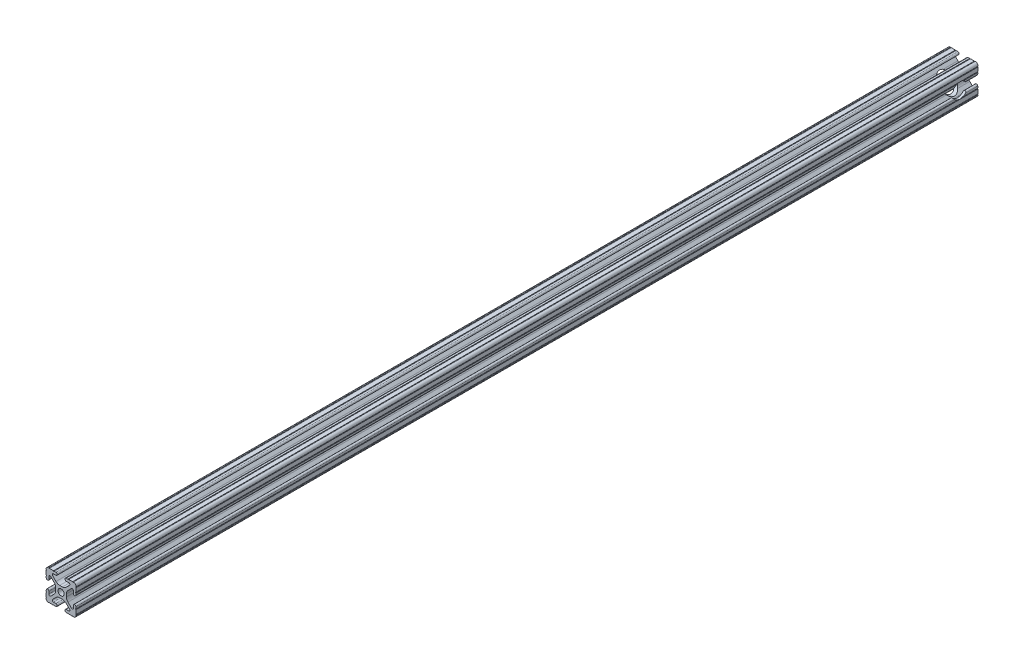
from build123d import *

# Parameters (mm, degrees)
SKETCH3_R               = 2.6035
EXTRUDE1_DEPTH          = 380
CUT_EXTRUDE2_DEPTH      = 381.601395783
CUT_EXTRUDE2_DEPTH_BACK = 381.601395783
SKETCH5_R               = 6.35


with BuildPart() as part:
    # Sketch3 → Extrude1 (new, symmetric)
    with BuildSketch(Plane.XY):
        with BuildLine():
            Line((-1.115277175, 4.5085), (1.115277175, 4.5085))
            ThreePointArc((1.115277175, 4.5085), (2.806584872, 4.844922018), (4.240406305, 5.80297087))
            Line((4.240406305, 5.80297087), (7.148423664, 8.710988229))
            ThreePointArc((7.148423664, 8.710988229), (7.349906316, 9.772227925), (6.436353897, 10.348636575))
            Line((6.436353897, 10.348636575), (4.381960454, 10.276895575))
            ThreePointArc((4.381960454, 10.276895575), (3.239173075, 11.342562046), (4.304839546, 12.485349424))
            Line((4.304839546, 12.485349424), (5.728246175, 12.535055879))
            ThreePointArc((5.728246175, 12.535055879), (6.054756855, 12.230579745), (6.35923299, 12.557090424))
            Line((6.35923299, 12.557090424), (9.782092278, 12.676619304))
            ThreePointArc((9.782092278, 12.676619304), (10.108602958, 12.37214317), (10.413079092, 12.69865385))
            ThreePointArc((10.413079092, 12.69865385), (12.052764565, 12.052764565), (12.69865385, 10.413079092))
            ThreePointArc((12.69865385, 10.413079092), (12.37214317, 10.108602958), (12.676619304, 9.782092278))
            Line((12.676619304, 9.782092278), (12.557090424, 6.35923299))
            ThreePointArc((12.557090424, 6.35923299), (12.230579745, 6.054756855), (12.535055879, 5.728246175))
            Line((12.535055879, 5.728246175), (12.485349424, 4.304839546))
            ThreePointArc((12.485349424, 4.304839546), (11.342562046, 3.239173075), (10.276895575, 4.381960454))
            Line((10.276895575, 4.381960454), (10.348636575, 6.436353897))
            ThreePointArc((10.348636575, 6.436353897), (9.772227925, 7.349906316), (8.710988229, 7.148423664))
            Line((8.710988229, 7.148423664), (5.80297087, 4.240406305))
            ThreePointArc((5.80297087, 4.240406305), (4.844922018, 2.806584872), (4.5085, 1.115277175))
            Line((4.5085, 1.115277175), (4.5085, -1.115277175))
            ThreePointArc((4.5085, -1.115277175), (4.844922018, -2.806584872), (5.80297087, -4.240406305))
            Line((5.80297087, -4.240406305), (8.710988229, -7.148423664))
            ThreePointArc((8.710988229, -7.148423664), (9.772227925, -7.349906316), (10.348636575, -6.436353897))
            Line((10.348636575, -6.436353897), (10.276895575, -4.381960454))
            ThreePointArc((10.276895575, -4.381960454), (11.342562046, -3.239173075), (12.485349424, -4.304839546))
            Line((12.485349424, -4.304839546), (12.535055879, -5.728246175))
            ThreePointArc((12.535055879, -5.728246175), (12.230579745, -6.054756855), (12.557090424, -6.35923299))
            Line((12.557090424, -6.35923299), (12.676619304, -9.782092278))
            ThreePointArc((12.676619304, -9.782092278), (12.37214317, -10.108602958), (12.69865385, -10.413079092))
            ThreePointArc((12.69865385, -10.413079092), (12.052764565, -12.052764565), (10.413079092, -12.69865385))
            ThreePointArc((10.413079092, -12.69865385), (10.108602958, -12.37214317), (9.782092278, -12.676619304))
            Line((9.782092278, -12.676619304), (6.35923299, -12.557090424))
            ThreePointArc((6.35923299, -12.557090424), (6.054756855, -12.230579745), (5.728246175, -12.535055879))
            Line((5.728246175, -12.535055879), (4.304839546, -12.485349424))
            ThreePointArc((4.304839546, -12.485349424), (3.239173075, -11.342562046), (4.381960454, -10.276895575))
            Line((4.381960454, -10.276895575), (6.436353897, -10.348636575))
            ThreePointArc((6.436353897, -10.348636575), (7.349906316, -9.772227925), (7.148423664, -8.710988229))
            Line((7.148423664, -8.710988229), (4.240406305, -5.80297087))
            ThreePointArc((4.240406305, -5.80297087), (2.806584872, -4.844922018), (1.115277175, -4.5085))
            Line((1.115277175, -4.5085), (-1.115277175, -4.5085))
            ThreePointArc((-1.115277175, -4.5085), (-2.806584872, -4.844922018), (-4.240406305, -5.80297087))
            Line((-4.240406305, -5.80297087), (-7.148423664, -8.710988229))
            ThreePointArc((-7.148423664, -8.710988229), (-7.349906316, -9.772227925), (-6.436353897, -10.348636575))
            Line((-6.436353897, -10.348636575), (-4.381960454, -10.276895575))
            ThreePointArc((-4.381960454, -10.276895575), (-3.239173075, -11.342562046), (-4.304839546, -12.485349424))
            Line((-4.304839546, -12.485349424), (-5.728246175, -12.535055879))
            ThreePointArc((-5.728246175, -12.535055879), (-6.054756855, -12.230579745), (-6.35923299, -12.557090424))
            Line((-6.35923299, -12.557090424), (-9.782092278, -12.676619304))
            ThreePointArc((-9.782092278, -12.676619304), (-10.108602958, -12.37214317), (-10.413079092, -12.69865385))
            ThreePointArc((-10.413079092, -12.69865385), (-12.052764565, -12.052764565), (-12.69865385, -10.413079092))
            ThreePointArc((-12.69865385, -10.413079092), (-12.37214317, -10.108602958), (-12.676619304, -9.782092278))
            Line((-12.676619304, -9.782092278), (-12.557090424, -6.35923299))
            ThreePointArc((-12.557090424, -6.35923299), (-12.230579745, -6.054756855), (-12.535055879, -5.728246175))
            Line((-12.535055879, -5.728246175), (-12.485349424, -4.304839546))
            ThreePointArc((-12.485349424, -4.304839546), (-11.342562046, -3.239173075), (-10.276895575, -4.381960454))
            Line((-10.276895575, -4.381960454), (-10.348636575, -6.436353897))
            ThreePointArc((-10.348636575, -6.436353897), (-9.772227925, -7.349906316), (-8.710988229, -7.148423664))
            Line((-8.710988229, -7.148423664), (-5.80297087, -4.240406305))
            ThreePointArc((-5.80297087, -4.240406305), (-4.844922018, -2.806584872), (-4.5085, -1.115277175))
            Line((-4.5085, -1.115277175), (-4.5085, 1.115277175))
            ThreePointArc((-4.5085, 1.115277175), (-4.844922018, 2.806584872), (-5.80297087, 4.240406305))
            Line((-5.80297087, 4.240406305), (-8.710988229, 7.148423664))
            ThreePointArc((-8.710988229, 7.148423664), (-9.772227925, 7.349906316), (-10.348636575, 6.436353897))
            Line((-10.348636575, 6.436353897), (-10.276895575, 4.381960454))
            ThreePointArc((-10.276895575, 4.381960454), (-11.342562046, 3.239173075), (-12.485349424, 4.304839546))
            Line((-12.485349424, 4.304839546), (-12.535055879, 5.728246175))
            ThreePointArc((-12.535055879, 5.728246175), (-12.230579745, 6.054756855), (-12.557090424, 6.35923299))
            Line((-12.557090424, 6.35923299), (-12.676619304, 9.782092278))
            ThreePointArc((-12.676619304, 9.782092278), (-12.37214317, 10.108602958), (-12.69865385, 10.413079092))
            ThreePointArc((-12.69865385, 10.413079092), (-12.052764565, 12.052764565), (-10.413079092, 12.69865385))
            ThreePointArc((-10.413079092, 12.69865385), (-10.108602958, 12.37214317), (-9.782092278, 12.676619304))
            Line((-9.782092278, 12.676619304), (-6.35923299, 12.557090424))
            ThreePointArc((-6.35923299, 12.557090424), (-6.054756855, 12.230579745), (-5.728246175, 12.535055879))
            Line((-5.728246175, 12.535055879), (-4.304839546, 12.485349424))
            ThreePointArc((-4.304839546, 12.485349424), (-3.239173075, 11.342562046), (-4.381960454, 10.276895575))
            Line((-4.381960454, 10.276895575), (-6.436353897, 10.348636575))
            ThreePointArc((-6.436353897, 10.348636575), (-7.349906316, 9.772227925), (-7.148423664, 8.710988229))
            Line((-7.148423664, 8.710988229), (-4.240406305, 5.80297087))
            ThreePointArc((-4.240406305, 5.80297087), (-2.806584872, 4.844922018), (-1.115277175, 4.5085))
        make_face()
        Circle(SKETCH3_R, mode=Mode.SUBTRACT)
    extrude(amount=EXTRUDE1_DEPTH, both=True)

    # Sketch5 → Cut-Extrude2 (cut, two sides: drawn at the far end of the back side and taken through both)
    with BuildSketch(Plane(origin=(4.5085, 0, 0), x_dir=(0, 0, -1), z_dir=(1, 0, 0)).offset(-CUT_EXTRUDE2_DEPTH_BACK)):
        with Locations((365, 0)):
            Circle(SKETCH5_R)
    extrude(amount=CUT_EXTRUDE2_DEPTH + CUT_EXTRUDE2_DEPTH_BACK, mode=Mode.SUBTRACT)


solid = part.part
